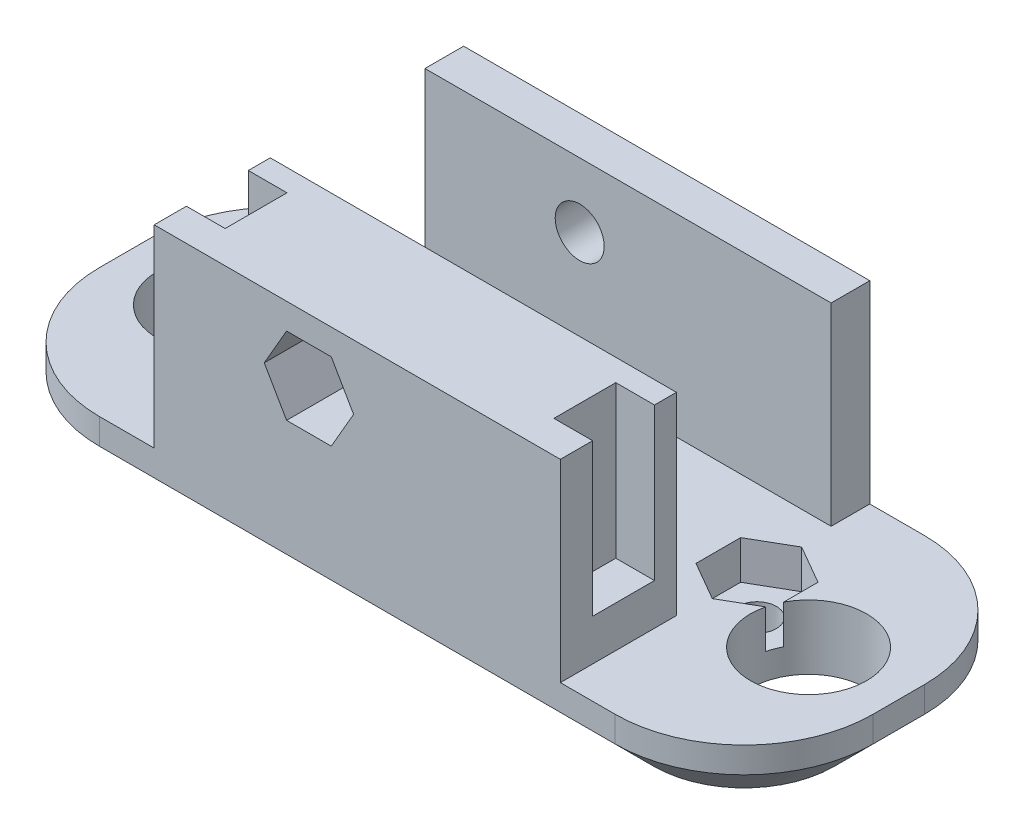
from build123d import *

# Parameters (mm, degrees)
SKETCH_1_W          = 60
SKETCH_1_H          = 24
EXTRUDE_1_DEPTH     = 5
SKETCH_2_W          = 31.5
SKETCH_2_H          = 9
SKETCH_2_H_2        = 3
EXTRUDE_2_DEPTH     = 15
SKETCH_3_R          = 1.9
CUT_EXTRUDE_1_DEPTH = 24
SKETCH_4_R          = 4.5
CUT_EXTRUDE_2_DEPTH = 24
FILLET_1_R          = 10
CUT_EXTRUDE_3_DEPTH = 3
SKETCH_7_R          = 1.5
CUT_EXTRUDE_4_DEPTH = 3
CUT_EXTRUDE_5_DEPTH = 6
SKETCH_9_W          = 4.8
SKETCH_9_H          = 12.477545801
CUT_EXTRUDE_6_DEPTH = 3
SKETCH_10_W         = 4.8
SKETCH_10_H         = 29.172350056
CUT_EXTRUDE_7_DEPTH = 3
CHAMFER_1_SIZE      = 3


with BuildPart() as part:
    # Эскиз1 → Бобышка-Вытянуть1 (new body)
    with BuildSketch(Plane(origin=(0, 0, 0), x_dir=(1, 0, 0), z_dir=(0, 1, 0))):
        with Locations((30, 12)):
            Rectangle(SKETCH_1_W, SKETCH_1_H)
    extrude(amount=EXTRUDE_1_DEPTH)

    # Эскиз2 → Бобышка-Вытянуть2 (add)
    with BuildSketch(Plane(origin=(0, 5, 0), x_dir=(1, 0, 0), z_dir=(0, 1, 0))):
        with Locations((30, 4.5)):
            Rectangle(SKETCH_2_W, SKETCH_2_H)
        with Locations((30, 22.5)):
            Rectangle(SKETCH_2_W, SKETCH_2_H_2)
    extrude(amount=EXTRUDE_2_DEPTH)

    # Эскиз3 → Вырез-Вытянуть1 (cut)
    with BuildSketch(Plane.XY):
        with Locations((26.25, 15)):
            Circle(SKETCH_3_R)
    extrude(amount=-CUT_EXTRUDE_1_DEPTH, mode=Mode.SUBTRACT)

    # Эскиз4 → Вырез-Вытянуть2 (cut)
    with BuildSketch(Plane.XZ):
        with Locations(Location((7, -12, 0), (0, 0, 270))):
            Circle(SKETCH_4_R)
        with Locations(Location((53, -12, 0), (0, 0, 270))):
            Circle(SKETCH_4_R)
    extrude(amount=-CUT_EXTRUDE_2_DEPTH, mode=Mode.SUBTRACT)

    # Скругление1
    fillet_1_edges = [part.edges().sort_by_distance(p)[0] for p in [
        (0, 2.5, -24),
        (60, 2.5, -24),
        (60, 2.5, 0),
        (0, 2.5, 0),
    ]]
    fillet(fillet_1_edges, radius=FILLET_1_R)

    # Эскиз5 → Вырез-Вытянуть3 (cut)
    with BuildSketch(Plane(origin=(0, 5, 0), x_dir=(1, 0, 0), z_dir=(0, 1, 0))):
        Polygon((43, 16.732050808), (43, 13.267949192), (46, 11.535898385), (49, 13.267949192), (49, 16.732050808), (46, 18.464101615), align=None)
        Polygon((11, 16.732050808), (11, 13.267949192), (14, 11.535898385), (17, 13.267949192), (17, 16.732050808), (14, 18.464101615), align=None)
    extrude(amount=-CUT_EXTRUDE_3_DEPTH, mode=Mode.SUBTRACT)

    # Эскиз7 → Вырез-Вытянуть4 (cut)
    with BuildSketch(Plane(origin=(0, 2, 0), x_dir=(1, 0, 0), z_dir=(0, 1, 0))):
        with Locations(Location((14, 15, 0), (0, 0, 270))):
            Circle(SKETCH_7_R)
        with Locations(Location((46, 15, 0), (0, 0, 270))):
            Circle(SKETCH_7_R)
    extrude(amount=-CUT_EXTRUDE_4_DEPTH, mode=Mode.SUBTRACT)

    # Эскиз8 → Вырез-Вытянуть5 (cut)
    with BuildSketch(Plane.XY):
        Polygon((27.982050808, 18), (24.517949192, 18), (22.785898385, 15), (24.517949192, 12), (27.982050808, 12), (29.714101615, 15), align=None)
    extrude(amount=-CUT_EXTRUDE_5_DEPTH, mode=Mode.SUBTRACT)

    # Эскиз9 → Вырез-Вытянуть6 (cut)
    with BuildSketch(Plane.ZY.offset(-14.25)):
        with Locations((-4.9, 14.445052705)):
            Rectangle(SKETCH_9_W, SKETCH_9_H)
    extrude(amount=-CUT_EXTRUDE_6_DEPTH, mode=Mode.SUBTRACT)

    # Эскиз10 → Вырез-Вытянуть7 (cut)
    with BuildSketch(Plane(origin=(45.75, 0, 0), x_dir=(0, 0, -1), z_dir=(1, 0, 0))):
        with Locations((4.9, 22.792454832)):
            Rectangle(SKETCH_10_W, SKETCH_10_H)
    extrude(amount=-CUT_EXTRUDE_7_DEPTH, mode=Mode.SUBTRACT)

    # Фаска1
    # the kernel refuses this chamfer: 3 mm, written as the material it takes off along each edge
    with BuildSketch(Plane(origin=(50, 0, -24), x_dir=(0, -0.02749587661058636, 0.9996219169112968), z_dir=(-1, 0, 0))) as chamfer_1_piece_1:
        Polygon((CHAMFER_1_SIZE * 0.999621916911, CHAMFER_1_SIZE * 0.0274958766106), (-CHAMFER_1_SIZE * 0.0274958766106, CHAMFER_1_SIZE * 0.999621916911), (0, 0), align=None)
    extrude(amount=40, mode=Mode.SUBTRACT)
    with BuildSketch(Plane(origin=(0, 0, -14), x_dir=(0.9996219169112968, -0.02749587661058636, 0), z_dir=(0, 0, 1)), Plane(origin=(60, 0, -10), x_dir=(-0.9996219169112968, -0.02749587661058636, 0), z_dir=(0, 0, -1))) as chamfer_1_piece_2:
        Polygon((CHAMFER_1_SIZE * 0.999621916911, CHAMFER_1_SIZE * 0.0274958766106), (-CHAMFER_1_SIZE * 0.0274958766106, CHAMFER_1_SIZE * 0.999621916911), (0, 0), align=None)
    extrude(amount=4, mode=Mode.SUBTRACT)
    with BuildSketch(Plane(origin=(10, 0, 0), x_dir=(0, 0.9996219169112968, 0.027495876610586372), z_dir=(1, 0, 0))) as chamfer_1_piece_3:
        Polygon((CHAMFER_1_SIZE * 0.999621916911, -CHAMFER_1_SIZE * 0.0274958766106), (-CHAMFER_1_SIZE * 0.0274958766106, -CHAMFER_1_SIZE * 0.999621916911), (0, 0), align=None)
    extrude(amount=40, mode=Mode.SUBTRACT)
    with BuildSketch(Plane(origin=(10, 0, -14), x_dir=(-1, 0, 0), z_dir=(0, 0, 1))) as chamfer_1_piece_4:
        Polygon((10 - CHAMFER_1_SIZE, 0), (10, -CHAMFER_1_SIZE), (10, 0), align=None)
    revolve(axis=Axis((10, 0, -14), (0, -1, 0)), revolution_arc=90, mode=Mode.SUBTRACT)
    with BuildSketch(Plane(origin=(10, 0, -10), x_dir=(0, 0, 1), z_dir=(1, 0, 0))) as chamfer_1_piece_5:
        Polygon((10 - CHAMFER_1_SIZE, 0), (10, -CHAMFER_1_SIZE), (10, 0), align=None)
    revolve(axis=Axis((10, 0, -10), (0, -1, 0)), revolution_arc=90, mode=Mode.SUBTRACT)
    with BuildSketch(Plane(origin=(50, 0, -10), x_dir=(0, 0, 1), z_dir=(-1, 0, 0))) as chamfer_1_piece_6:
        Polygon((10 - CHAMFER_1_SIZE, 0), (10, CHAMFER_1_SIZE), (10, 0), align=None)
    revolve(axis=Axis((50, 0, -10), (0, 1, 0)), revolution_arc=90, mode=Mode.SUBTRACT)
    with BuildSketch(Plane(origin=(50, 0, -14), x_dir=(1, 0, 0), z_dir=(0, 0, 1))) as chamfer_1_piece_7:
        Polygon((10 - CHAMFER_1_SIZE, 0), (10, CHAMFER_1_SIZE), (10, 0), align=None)
    revolve(axis=Axis((50, 0, -14), (0, 1, 0)), revolution_arc=90, mode=Mode.SUBTRACT)


solid = part.part
